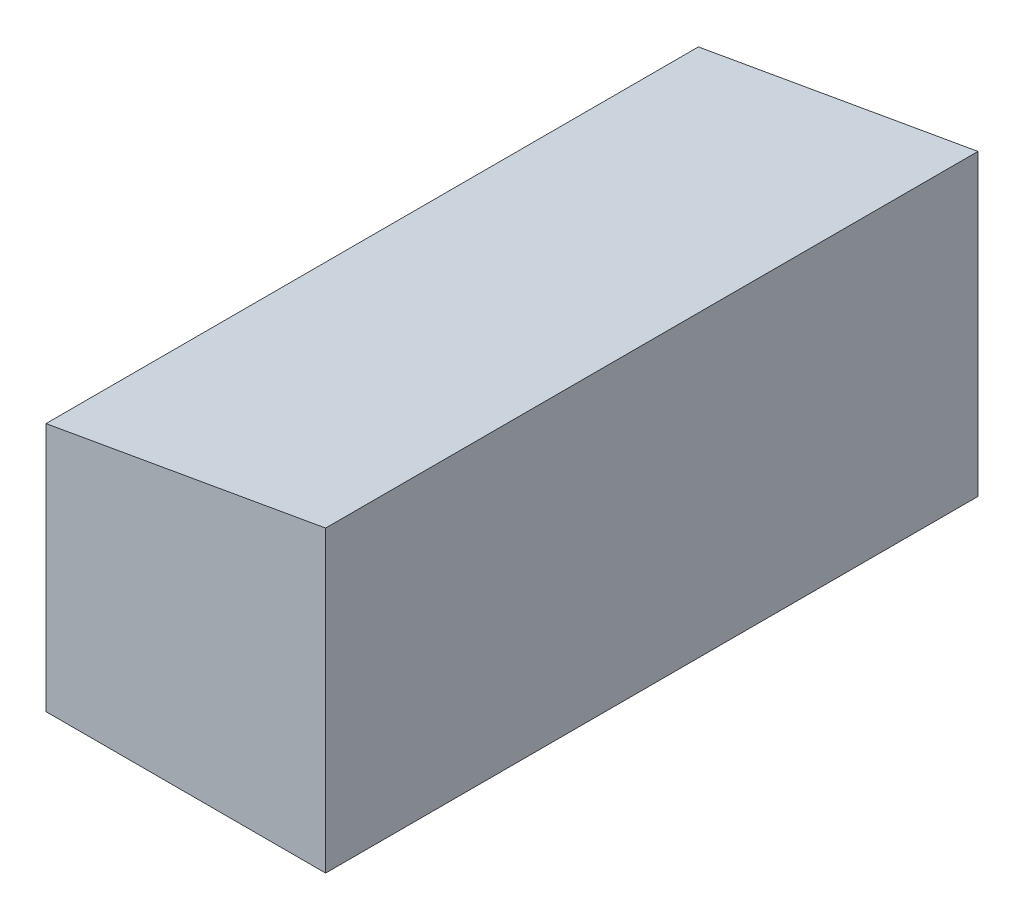
from build123d import *

# Parameters (mm, degrees)
BOSS_EXTRUDE1_DEPTH = 88.9


with BuildPart() as part:
    # Sketch1 → Boss-Extrude1 (new body)
    with BuildSketch(Plane.XY):
        Polygon((38.1, 40.718057965), (0, 34), (0, 0), (38.1, 0), align=None)
    extrude(amount=BOSS_EXTRUDE1_DEPTH)


solid = part.part
